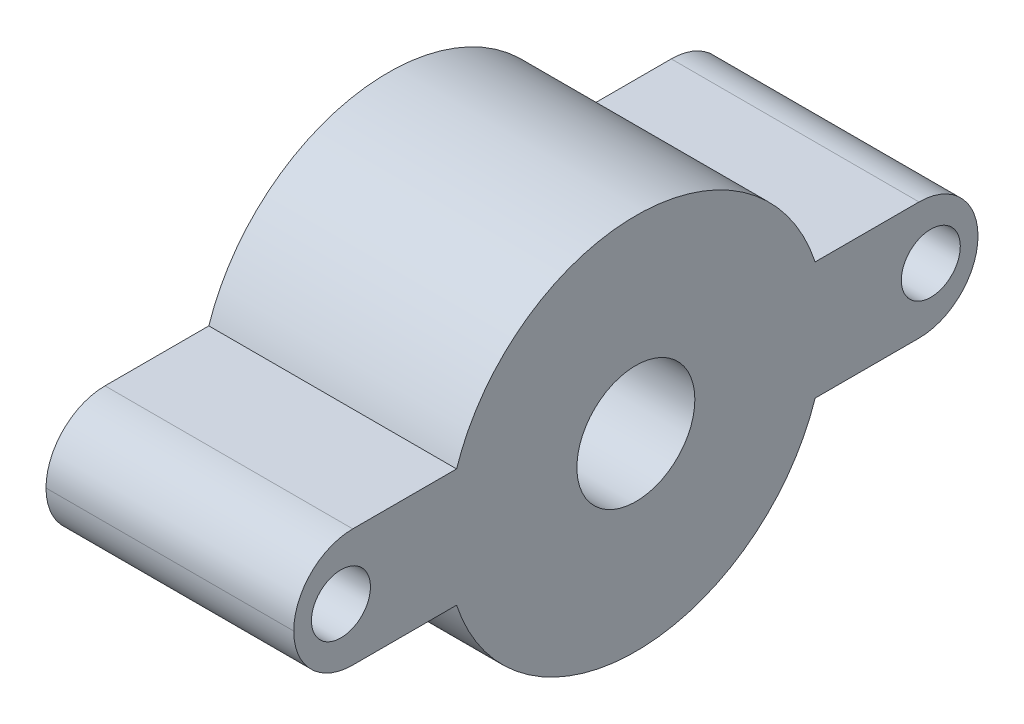
from build123d import *

# Parameters (mm, degrees)
SKETCH1_W                = 70
SKETCH1_H                = 10
BOSS_EXTRUDE1_DEPTH      = 5
BOSS_EXTRUDE2_DEPTH      = 16
BOSS_EXTRUDE2_DEPTH_BACK = 5
SKETCH2_R                = 16
SKETCH3_W                = 70
SKETCH3_H                = 10
BOSS_EXTRUDE3_DEPTH      = 16
SKETCH4_R                = 2.5
CUT_EXTRUDE1_DEPTH       = 11
SKETCH5_R                = 1.5
CUT_EXTRUDE2_DEPTH       = 38
SKETCH6_R                = 12
CUT_EXTRUDE3_DEPTH       = 11
SKETCH7_R                = 5
CUT_EXTRUDE4_DEPTH       = 40
SKETCH8_W                = 6
SKETCH8_H                = 10
CUT_EXTRUDE5_DEPTH       = 40
FILLET1_R                = 5
FILLET2_R                = 5
FILLET3_R                = 5
FILLET4_R                = 5


with BuildPart() as part:
    # Sketch1 → Boss-Extrude1 (new body)
    with BuildSketch(Plane(origin=(0, 0, 0), x_dir=(0, 0, -1), z_dir=(1, 0, 0))):
        with Locations((35, 5)):
            Rectangle(SKETCH1_W, SKETCH1_H)
    extrude(amount=BOSS_EXTRUDE1_DEPTH)

    # Sketch2 → Boss-Extrude2 (add, two sides: drawn at the far end of the back side and taken through both)
    with BuildSketch(Plane(origin=(5, 0, 0), x_dir=(0, 0, -1), z_dir=(1, 0, 0)).offset(-BOSS_EXTRUDE2_DEPTH_BACK)):
        with Locations(Location((35, 5, 0), (0, 0, 161.790043136))):
            Circle(SKETCH2_R)
    extrude(amount=BOSS_EXTRUDE2_DEPTH + BOSS_EXTRUDE2_DEPTH_BACK)

    # Sketch3 → Boss-Extrude3 (add)
    with BuildSketch(Plane(origin=(5, 0, 0), x_dir=(0, 0, -1), z_dir=(1, 0, 0))):
        with Locations((35, 5)):
            Rectangle(SKETCH3_W, SKETCH3_H)
    extrude(amount=BOSS_EXTRUDE3_DEPTH)

    # Sketch4 → Cut-Extrude1 (cut)
    with BuildSketch(Plane(origin=(21, 0, 0), x_dir=(0, 0, -1), z_dir=(1, 0, 0))):
        with Locations((10, 5)):
            Circle(SKETCH4_R)
        with Locations((60, 5)):
            Circle(SKETCH4_R)
    extrude(amount=-CUT_EXTRUDE1_DEPTH, mode=Mode.SUBTRACT)

    # Sketch5 → Cut-Extrude2 (cut)
    with BuildSketch(Plane(origin=(21, 0, 0), x_dir=(0, 0, -1), z_dir=(1, 0, 0))):
        with Locations((10, 5)):
            Circle(SKETCH5_R)
        with Locations((60, 5)):
            Circle(SKETCH5_R)
    extrude(amount=-CUT_EXTRUDE2_DEPTH, mode=Mode.SUBTRACT)

    # Sketch6 → Cut-Extrude3 (cut)
    with BuildSketch(Plane.ZY):
        with Locations((-35, 5)):
            Circle(SKETCH6_R)
    extrude(amount=-CUT_EXTRUDE3_DEPTH, mode=Mode.SUBTRACT)

    # Sketch7 → Cut-Extrude4 (cut)
    with BuildSketch(Plane(origin=(21, 0, 0), x_dir=(0, 0, -1), z_dir=(1, 0, 0))):
        with Locations((35, 5)):
            Circle(SKETCH7_R)
    extrude(amount=-CUT_EXTRUDE4_DEPTH, mode=Mode.SUBTRACT)

    # Sketch8 → Cut-Extrude5 (cut)
    with BuildSketch(Plane.ZY):
        with Locations((-67, 5)):
            Rectangle(SKETCH8_W, SKETCH8_H)
        with Locations((-3, 5)):
            Rectangle(SKETCH8_W, SKETCH8_H)
    extrude(amount=-CUT_EXTRUDE5_DEPTH, mode=Mode.SUBTRACT)

    # Fillet1
    fillet1_edges = [part.edges().sort_by_distance(p)[0] for p in [
        (10.5, 10, -64),
    ]]
    fillet(fillet1_edges, radius=FILLET1_R)

    # Fillet2
    fillet2_edges = [part.edges().sort_by_distance(p)[0] for p in [
        (10.5, 10, -6),
    ]]
    fillet(fillet2_edges, radius=FILLET2_R)

    # Fillet3
    fillet3_edges = [part.edges().sort_by_distance(p)[0] for p in [
        (10.5, 0, -6),
    ]]
    fillet(fillet3_edges, radius=FILLET3_R - 0.0001)  # a hair under: the kernel refuses the full size

    # Fillet4
    fillet4_edges = [part.edges().sort_by_distance(p)[0] for p in [
        (10.5, 0, -64),
    ]]
    fillet(fillet4_edges, radius=FILLET4_R - 0.0001)  # a hair under: the kernel refuses the full size


solid = part.part
